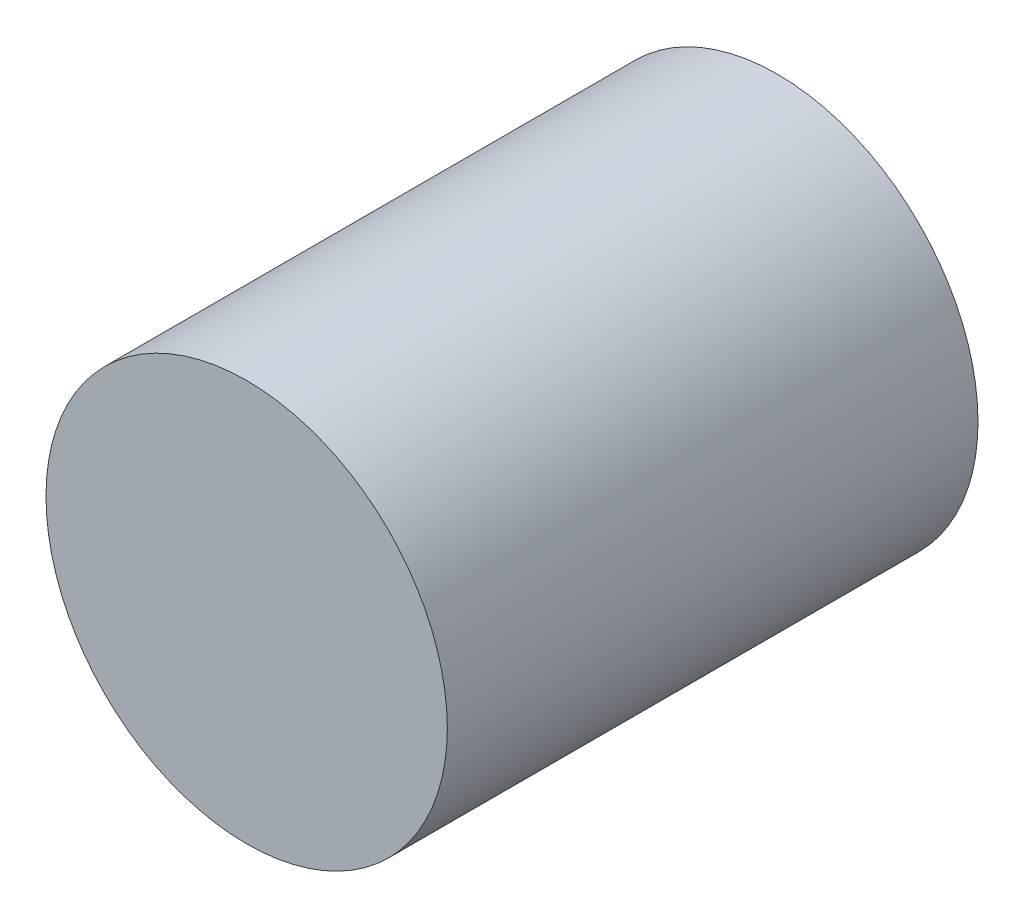
from build123d import *

# Parameters (mm, degrees)
ESBO_O1_R                = 15.125
RESSALTO_EXTRUS_O1_DEPTH = 40


with BuildPart() as part:
    # Esboço1 → Ressalto-extrusão1 (new body)
    with BuildSketch(Plane.XY):
        Circle(ESBO_O1_R)
    extrude(amount=RESSALTO_EXTRUS_O1_DEPTH)


solid = part.part
